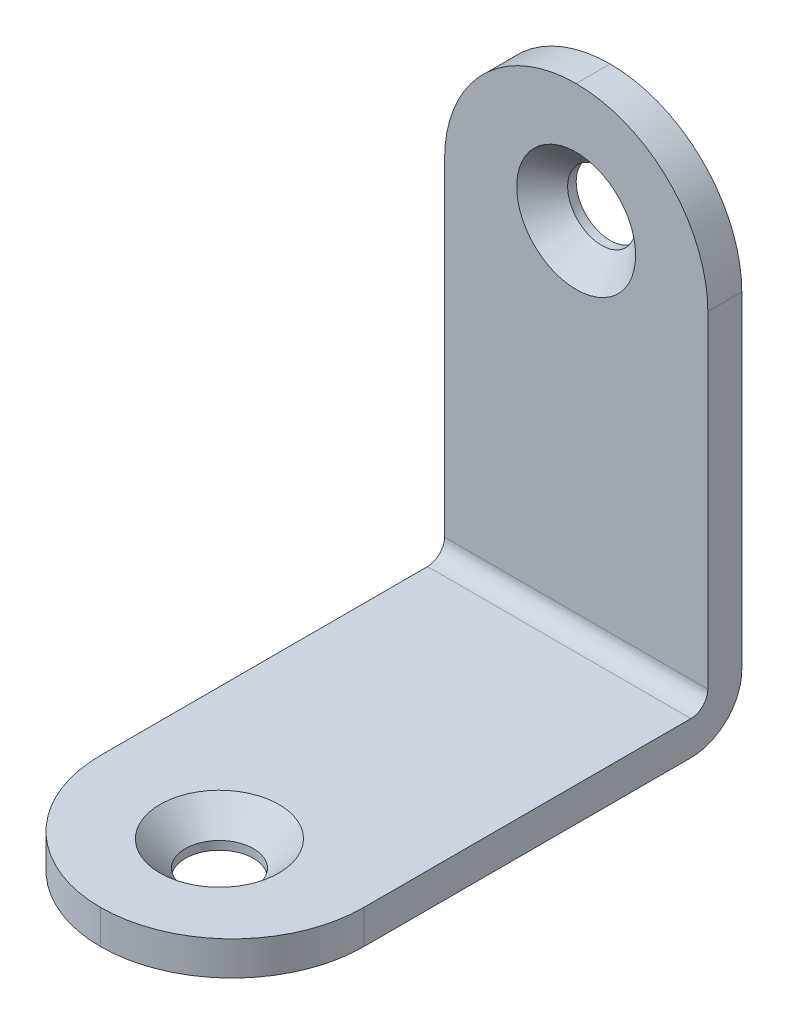
from build123d import *

# Parameters (mm, degrees)
EXTRUDE_1_DEPTH      = 7.75
EXTRUDE_1_DEPTH_BACK = 7.75
SKETCH_3_R           = 2
CUT_EXTRUDE_2_DEPTH  = 15.5
SKETCH_4_R           = 2
CUT_EXTRUDE_3_DEPTH  = 15.5
FILLET_1_R           = 7.75
CHAMFER_1_SIZE       = 1.5


with BuildPart() as part:
    # 草图1 → 凸台-拉伸1 (new, two sides: drawn at the far end of the back side and taken through both)
    with BuildSketch(Plane(origin=(0, 0, 0), x_dir=(0, 0, -1), z_dir=(1, 0, 0)).offset(-EXTRUDE_1_DEPTH_BACK)):
        with BuildLine():
            Line((-30, 0), (-3, 0))
            ThreePointArc((-3, 0), (-0.878679656, 0.878679656), (0, 3))
            Line((0, 3), (0, 30))
            Line((0, 30), (-2, 30))
            Line((-2, 30), (-2, 3))
            ThreePointArc((-2, 3), (-2.292893219, 2.292893219), (-3, 2))
            Line((-3, 2), (-30, 2))
            Line((-30, 2), (-30, 0))
        make_face()
    extrude(amount=EXTRUDE_1_DEPTH + EXTRUDE_1_DEPTH_BACK)

    # 草图3 → 切除-拉伸2 (cut)
    with BuildSketch(Plane(origin=(0, 2, 0), x_dir=(1, 0, 0), z_dir=(0, 1, 0))):
        with Locations(Location((0, -23, 0), (0, 0, 270))):
            Circle(SKETCH_3_R)
    extrude(amount=-CUT_EXTRUDE_2_DEPTH, mode=Mode.SUBTRACT)

    # 草图4 → 切除-拉伸3 (cut)
    with BuildSketch(Plane.XY.offset(2)):
        with Locations((0, 23)):
            Circle(SKETCH_4_R)
    extrude(amount=-CUT_EXTRUDE_3_DEPTH, mode=Mode.SUBTRACT)

    # 圆角1
    fillet_1_edges = [part.edges().sort_by_distance(p)[0] for p in [
        (7.75, 30, 1),
        (-7.75, 30, 1),
        (7.75, 1, 30),
        (-7.75, 1, 30),
    ]]
    fillet(fillet_1_edges, radius=FILLET_1_R - 0.0001)  # a hair under: the kernel refuses the full size

    # 倒角1
    chamfer_1_edges = [part.edges().sort_by_distance(p)[0] for p in [
        (0, 2, 21),
        (-2, 23, 2),
    ]]
    chamfer(chamfer_1_edges, length=CHAMFER_1_SIZE)


solid = part.part
